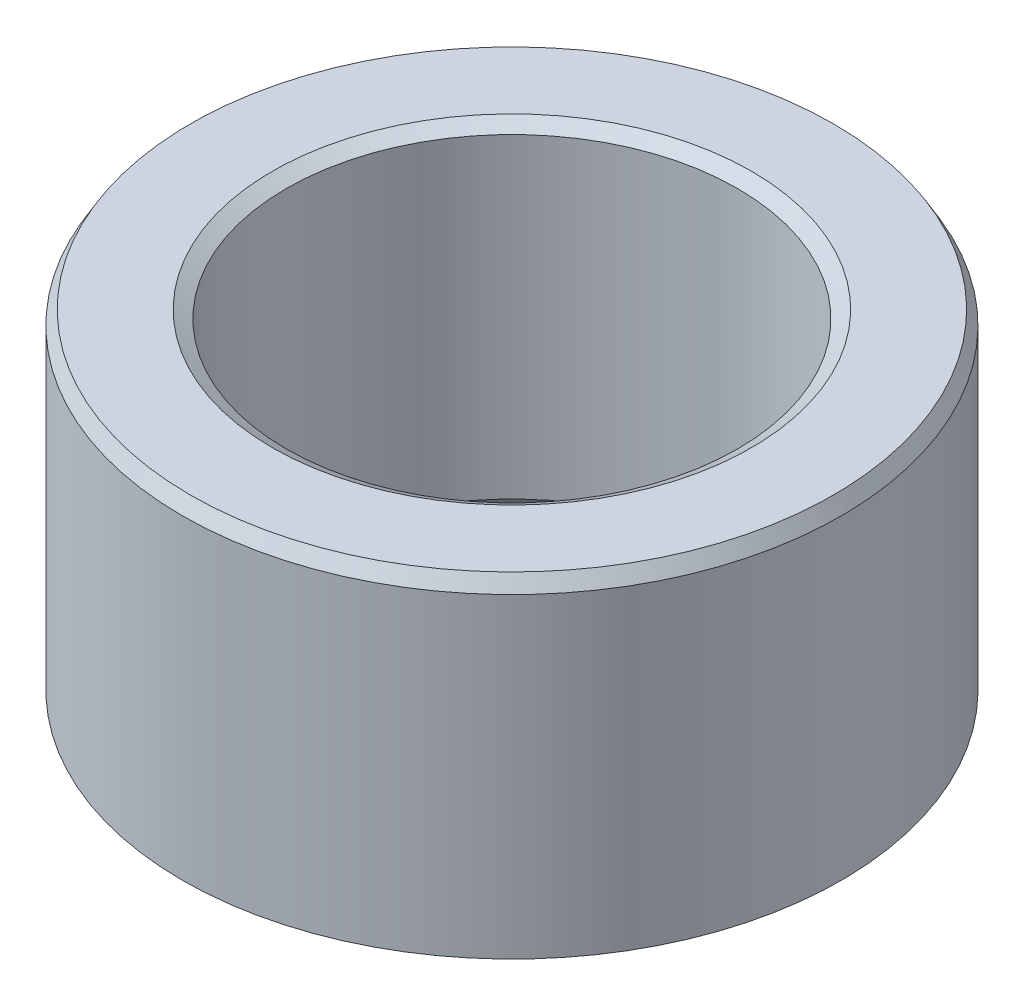
from build123d import *
from OCP.BRepFilletAPI import BRepFilletAPI_MakeChamfer

# Parameters (mm, degrees)
SKETCH1_R           = 17.5
BOSS_EXTRUDE1_DEPTH = 17.927188262
SKETCH2_R           = 11.980228742
CUT_EXTRUDE1_DEPTH  = 31.559516995
CHAMFER1_SIZE       = 0.739163284
CHAMFER1_SIZE2      = 0.426756121


with BuildPart() as part:
    # Sketch1 → Boss-Extrude1 (new body)
    with BuildSketch(Plane(origin=(0, 0, 0), x_dir=(1, 0, 0), z_dir=(0, 1, 0))):
        Circle(SKETCH1_R)
    extrude(amount=BOSS_EXTRUDE1_DEPTH)

    # Sketch2 → Cut-Extrude1 (cut, through all)
    with BuildSketch(Plane(origin=(0, 0, 0), x_dir=(1, 0, 0), z_dir=(0, 1, 0))):
        Circle(SKETCH2_R)
    extrude(amount=CUT_EXTRUDE1_DEPTH, mode=Mode.SUBTRACT)

    # Chamfer1: one chamfer whose edges measure the first distance from different faces: ONE call of the kernel's chamfer builder (chamfer() names one face for all edges)
    chamfer1_edges_1 = [part.edges().sort_by_distance(p)[0] for p in [
        (-11.980228742, 17.927188262, 0),
    ]]
    chamfer1_side_1 = [part.faces().sort_by_distance(p)[0] for p in [
        (-17.005025253, 17.927188262, 0),
    ]]
    chamfer1_edges_2 = [part.edges().sort_by_distance(p)[0] for p in [
        (-11.980228742, 0, 0),
    ]]
    chamfer1_side_2 = [part.faces().sort_by_distance(p)[0] for p in [
        (-11.980228742, 8.963594131, 0),
    ]]
    chamfer1_edges_3 = [part.edges().sort_by_distance(p)[0] for p in [
        (-17.5, 0, 0),
    ]]
    chamfer1_side_3 = [part.faces().sort_by_distance(p)[0] for p in [
        (-17.005025253, 0, 0),
    ]]
    chamfer1_edges_4 = [part.edges().sort_by_distance(p)[0] for p in [
        (-17.5, 17.927188262, 0),
    ]]
    chamfer1_side_4 = [part.faces().sort_by_distance(p)[0] for p in [
        (-17.5, 8.963594131, 0),
    ]]
    chamfer1 = BRepFilletAPI_MakeChamfer(part.part.solid().wrapped)
    for e in chamfer1_edges_1:
        chamfer1.Add(CHAMFER1_SIZE, CHAMFER1_SIZE2, e.wrapped, chamfer1_side_1[0].wrapped)  # the first distance lies on this face
    for e in chamfer1_edges_2:
        chamfer1.Add(CHAMFER1_SIZE, CHAMFER1_SIZE2, e.wrapped, chamfer1_side_2[0].wrapped)  # the first distance lies on this face
    for e in chamfer1_edges_3:
        chamfer1.Add(CHAMFER1_SIZE, CHAMFER1_SIZE2, e.wrapped, chamfer1_side_3[0].wrapped)  # the first distance lies on this face
    for e in chamfer1_edges_4:
        chamfer1.Add(CHAMFER1_SIZE, CHAMFER1_SIZE2, e.wrapped, chamfer1_side_4[0].wrapped)  # the first distance lies on this face
    add(Compound.cast(chamfer1.Shape()), mode=Mode.REPLACE)


solid = part.part
